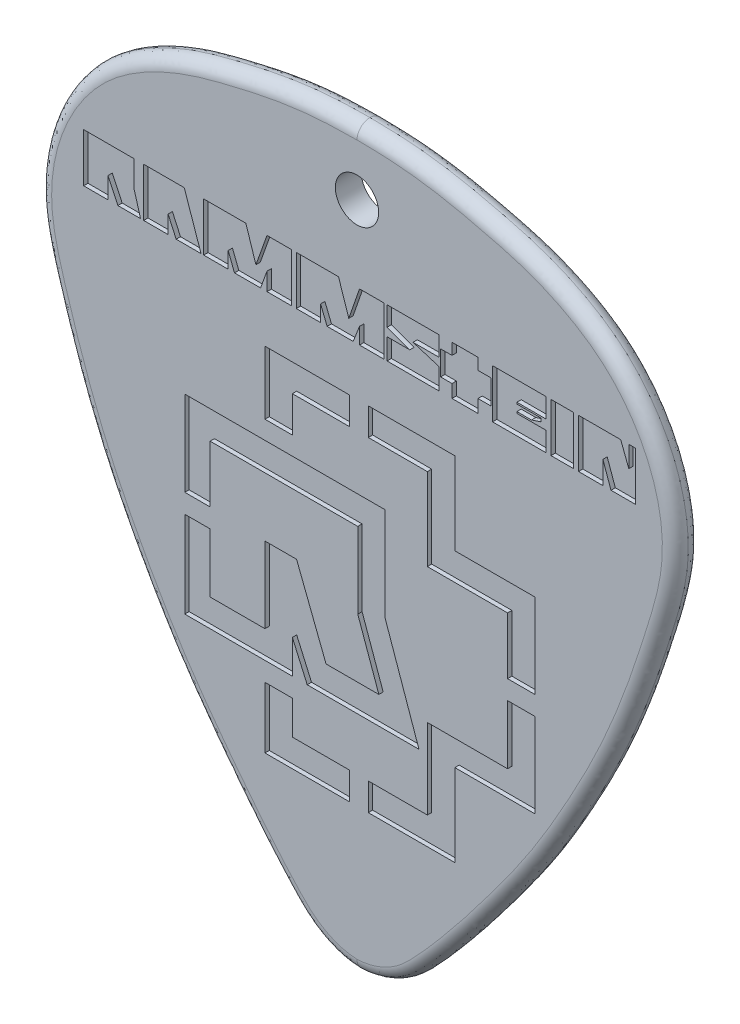
from build123d import *

# Parameters (mm, degrees)
SKETCH9_R        = 1
MEDIATOR_2_DEPTH = 1.2
FILLET3_R        = 0.6
SKETCH10_W       = 1.050702479
SKETCH10_H       = 2.250232432
RAMMSTEIN_DEPTH  = 0.2
LOGO_DEPTH       = 0.2


with BuildPart() as part:
    # Sketch9 → mediator_2 (new body)
    with BuildSketch(Plane(origin=(-49.965216279, -1.979822501, 0), x_dir=(1, 0, 0), z_dir=(0, 0, 1))):
        with BuildLine():
            add(Edge.make_bspline(
                [(49.931230745, 18.028684681), (50.582243946, 18.023814879), (52.043470106, 17.988658085), (54.030465134, 17.703270596), (55.988021275, 17.25291722), (58.008761561, 16.733725825), (60.009444112, 15.862204424), (62.656118403, 14.028903422), (64.46161524, 11.053836142), (64.787470999, 7.374918116), (63.92825613, 4.458872412), (62.944611771, 1.433211261), (61.711722581, -1.57446886), (60.178484112, -4.507343213), (58.560669713, -7.29495534), (56.643481387, -9.964563797), (54.862784697, -12.27473571), (53.389314449, -13.994517037), (51.989942305, -15.44287428), (50.793527189, -15.942058097), (49.931230745, -15.965332669)],
                knots=[0, 0, 0, 0, 0.039894423, 0.08944965, 0.122624421, 0.16295736, 0.217169457, 0.255208181, 0.359361282, 0.416146348, 0.477175106, 0.543509161, 0.611613991, 0.675828933, 0.746189243, 0.808840218, 0.877030991, 0.924799446, 0.947638482, 1, 1, 1, 1], degree=3))
            add(Edge.make_bspline(
                [(49.931230745, 18.028684681), (49.280217544, 18.023814879), (47.818991383, 17.988658085), (45.831996356, 17.703270596), (43.874440215, 17.25291722), (41.853699929, 16.733725825), (39.853017378, 15.862204424), (37.206343086, 14.028903422), (35.40084625, 11.053836142), (35.074990491, 7.374918116), (35.93420536, 4.458872412), (36.917849719, 1.433211261), (38.150738909, -1.57446886), (39.683977378, -4.507343213), (41.301791777, -7.29495534), (43.218980103, -9.964563797), (44.999676793, -12.27473571), (46.47314704, -13.994517037), (47.872519185, -15.44287428), (49.068934301, -15.942058097), (49.931230745, -15.965332669)],
                knots=[0, 0, 0, 0, 0.039894423, 0.08944965, 0.122624421, 0.16295736, 0.217169457, 0.255208181, 0.359361282, 0.416146348, 0.477175106, 0.543509161, 0.611613991, 0.675828933, 0.746189243, 0.808840218, 0.877030991, 0.924799446, 0.947638482, 1, 1, 1, 1], degree=3))
        make_face()
        with Locations((49.931230745, 15.028684681)):
            Circle(SKETCH9_R, mode=Mode.SUBTRACT)
    extrude(amount=-MEDIATOR_2_DEPTH)

    # Fillet3
    fillet3_edges = [part.edges().sort_by_distance(p)[0] for p in [
        (-13.707988939, 1.505170258, -1.2),
        (-13.707988939, 1.505170258, 0),
    ]]
    fillet(fillet3_edges, radius=FILLET3_R - 0.0001)  # a hair under: the kernel refuses the full size

    # Sketch10 → Rammstein (cut)
    with BuildSketch(Plane(origin=(-49.965216279, -1.979822501, 0), x_dir=(1, 0, 0), z_dir=(0, 0, 1))):
        Polygon((38.419021389, 10.249485822), (38.877097738, 9.278452249), (39.925936668, 9.278452249), (39.621277447, 10.336801528), (39.621277447, 11.528684681), (37.294336899, 11.528684681), (37.294336899, 9.278452249), (38.419021389, 9.278452249), align=None)
        Polygon((41.944727039, 11.528684681), (42.720334975, 9.278452249), (41.572656981, 9.278452249), (41.199425922, 10.098608881), (41.199425922, 9.278452249), (40.070359476, 9.278452249), (40.070359476, 11.528684681), align=None)
        Polygon((45.769594368, 11.528684681), (46.896888509, 11.528684681), (46.896888509, 9.278452249), (45.769594368, 9.278452249), (45.769594368, 10.098608881), (45.472371333, 9.278452249), (44.268194636, 9.278452249), (43.974431549, 10.026692941), (43.974431549, 9.278452249), (42.845168824, 9.278452249), (42.845168824, 11.528684681), (44.793987771, 11.528684681), (45.258145998, 10.098608881), align=None)
        Polygon((50.046566392, 9.278452249), (50.046566392, 10.026692941), (49.752763193, 9.278452249), (48.549951463, 9.278452249), (48.247220215, 10.026692941), (48.247220215, 9.278452249), (47.123649592, 9.278452249), (47.123649592, 11.528684681), (49.076792809, 11.528684681), (49.550134677, 10.098608881), (50.046566392, 11.528684681), (51.176270516, 11.528684681), (51.176270516, 9.278452249), align=None)
        Polygon((53.724961512, 10.253433052), (53.724961512, 9.278452249), (51.320594675, 9.278452249), (51.320594675, 10.249485822), (52.370179609, 10.249485822), (51.320594675, 10.627674023), (51.320594675, 11.528684681), (53.724961512, 11.528684681), (53.724961512, 10.627674023), (52.519696498, 10.627674023), align=None)
        Polygon((55.520008898, 9.278452249), (55.520008898, 9.877439573), (56.121190268, 9.877439573), (56.121190268, 11.003174281), (55.520008898, 11.003174281), (55.520008898, 11.528684681), (54.32023226, 11.528684681), (54.32023226, 11.003174281), (53.794446345, 11.003174281), (53.794446345, 9.877439573), (54.32023226, 9.877439573), (54.32023226, 9.278452249), align=None)
        Polygon((58.66954546, 10.178266188), (58.66954546, 9.278452249), (56.195190687, 9.278452249), (56.195190687, 11.528684681), (58.66954546, 11.528684681), (58.66954546, 10.627674023), (57.320242565, 10.627674023), (57.320242565, 10.553065279), (58.444827617, 10.553065279), (58.444827617, 10.403568465), (57.994894012, 10.253433052), (57.31888261, 10.253433052), (57.31888261, 10.178266188), align=None)
        Polygon((61.295072182, 10.328074232), (61.66979322, 9.278452249), (62.794843764, 9.278452249), (62.794843764, 11.528684681), (62.494173514, 11.528684681), (62.494173514, 10.553065279), (62.119014898, 11.528684681), (60.168750182, 11.528684681), (60.168750182, 9.278452249), (61.295072182, 9.278452249), align=None)
        with Locations((59.419171943, 10.403568465)):
            Rectangle(SKETCH10_W, SKETCH10_H)
    extrude(amount=-RAMMSTEIN_DEPTH, mode=Mode.SUBTRACT)

    # Sketch11 → Logo (cut)
    with BuildSketch(Plane.XY):
        Polygon((-0.390223557, 3.801860416), (-3.02248737, 3.801860416), (-3.02248737, 2.144669288), (-4.290051989, 2.144669288), (-4.290051989, 5.069827972), (-0.390223557, 5.069827972), align=None)
        Polygon((0.486720815, 3.801860416), (3.216848916, 3.801860416), (3.216848916, 0), (6.923677546, 0), (6.923677546, -2.632702204), (8.190011687, -2.632702204), (8.190011687, 1.267394644), (4.486455806, 1.267394644), (4.486455806, 5.069827972), (0.486720815, 5.069827972), align=None)
        Polygon((8.190011687, -3.511035019), (8.190011687, -7.410186917), (4.486455806, -7.410186917), (4.486455806, -11.213446474), (0.487332448, -11.213446474), (0.487332448, -9.944965985), (3.217308164, -9.944965985), (3.217308164, -6.239078263), (6.923677546, -6.239078263), (6.923677546, -3.511035019), align=None)
        Polygon((-4.290051989, -8.385048506), (-4.290051989, -11.213446474), (-0.390223557, -11.213446474), (-0.390223557, -9.944965985), (-3.02248737, -9.944965985), (-3.02248737, -8.385048506), align=None)
        Polygon((-7.995096048, -2.632702204), (-6.823119032, -2.632702204), (-6.823119032, 0), (0, 0), (0, -3.511035019), (0.975002693, -6.239078263), (-1.465399519, -6.239078263), (-2.827474292, -2.729888481), (-4.290051989, -2.729888481), (-4.290051989, -6.239078263), (-6.823119032, -6.239078263), (-6.823119032, -3.511035019), (-7.995096048, -3.511035019), (-7.995096048, -7.507445215), (-3.02248737, -7.507445215), (-3.02248737, -5.953502873), (-2.335907851, -7.507445215), (2.829463426, -7.507445215), (1.268965442, -3.052669489), (1.268965442, 1.298876526), (-7.995096048, 1.298876526), align=None)
    extrude(amount=-LOGO_DEPTH, mode=Mode.SUBTRACT)


solid = part.part
